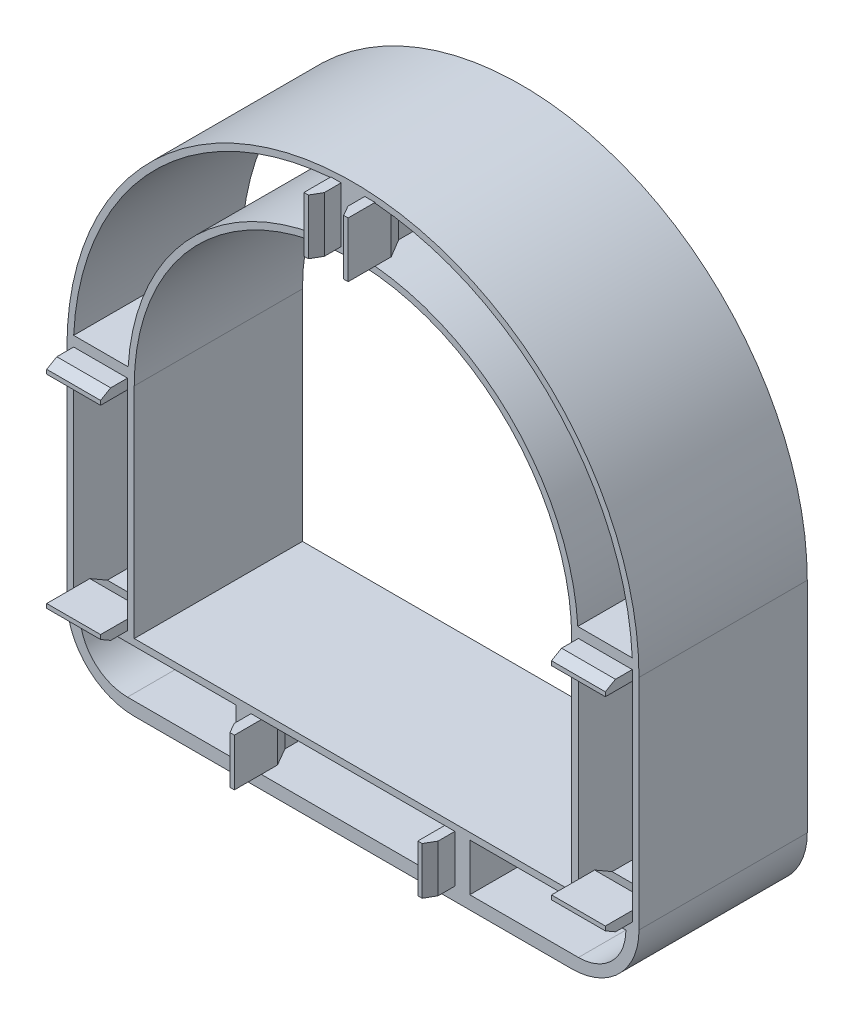
from build123d import *
from OCP.BRepFilletAPI import BRepFilletAPI_MakeChamfer

# Parameters (mm, degrees)
CROQUIS1_W              = 16
CROQUIS1_H              = 65
CROQUIS1_W_2            = 60.56813556
CROQUIS1_H_2            = 14.096609531
SALIENTE_EXTRUIR1_DEPTH = 50
CROQUIS3_W              = 16
CROQUIS3_H              = 3
CROQUIS3_W_2            = 3.053388568
CROQUIS3_H_2            = 16.41437111
CROQUIS3_W_3            = 3.044949639
CROQUIS3_H_3            = 14.096609531
CROQUIS3_W_4            = 3.024386733
SALIENTE_EXTRUIR2_DEPTH = 18
CHAFL_N2_SIZE           = 3
CHAFL_N2_SIZE2          = 1.732050808
CHAFL_N3_SIZE           = 5.196152423
CHAFL_N3_SIZE_2         = 3


with BuildPart() as part:
    # Croquis1 → Saliente-Extruir1 (new body)
    with BuildSketch(Plane.XY):
        with BuildLine():
            Line((-85, 0), (-85, -65))
            ThreePointArc((-85, -65), (-79.142135624, -79.142135624), (-65, -85))
            Line((-65, -85), (65, -85))
            ThreePointArc((65, -85), (79.142135624, -79.142135624), (85, -65))
            Line((85, -65), (85, 0))
            ThreePointArc((85, 0), (0, 85), (-85, 0))
        make_face()
        with Locations((75, -31.476837664)):
            Rectangle(CROQUIS1_W, CROQUIS1_H, mode=Mode.SUBTRACT)
        with BuildLine():
            Line((-65, -65), (65, -65))
            Line((65, -65), (65, 0))
            ThreePointArc((65, 0), (0, 65), (-65, 0))
            Line((-65, 0), (-65, -65))
        make_face(mode=Mode.SUBTRACT)
        with Locations((-75, -31.476837664)):
            Rectangle(CROQUIS1_W, CROQUIS1_H, mode=Mode.SUBTRACT)
        with BuildLine():
            Line((3.510152615, 83.023277843), (3.510152615, 66.83939974))
            ThreePointArc((3.510152615, 66.83939974), (47.145709065, 47.509037517), (66.810483413, 4.023162336))
            Line((66.810483413, 4.023162336), (83, 4.023162336))
            ThreePointArc((83, 4.023162336), (58.576925397, 58.940051292), (3.510152615, 83.023277843))
        make_face(mode=Mode.SUBTRACT)
        with BuildLine():
            Line((-66.810483413, 4.023162336), (-83, 4.023162336))
            ThreePointArc((-83, 4.023162336), (-58.576925397, 58.940051292), (-3.510152615, 83.023277843))
            Line((-3.510152615, 83.023277843), (-3.510152615, 66.83939974))
            ThreePointArc((-3.510152615, 66.83939974), (-47.145709065, 47.509037517), (-66.810483413, 4.023162336))
        make_face(mode=Mode.SUBTRACT)
        with BuildLine():
            Line((-81.096609531, -66.976837664), (-34.71593222, -66.976837664))
            Line((-34.71593222, -66.976837664), (-34.71593222, -81.073447195))
            Line((-34.71593222, -81.073447195), (-67, -81.073447195))
            ThreePointArc((-67, -81.073447195), (-76.967808191, -76.944645855), (-81.096609531, -66.976837664))
        make_face(mode=Mode.SUBTRACT)
        with BuildLine():
            Line((67, -81.073447195), (34.71593222, -81.073447195))
            Line((34.71593222, -81.073447195), (34.71593222, -66.976837664))
            Line((34.71593222, -66.976837664), (81.096609531, -66.976837664))
            ThreePointArc((81.096609531, -66.976837664), (76.967808191, -76.944645855), (67, -81.073447195))
        make_face(mode=Mode.SUBTRACT)
        with Locations((0, -74.025142429)):
            Rectangle(CROQUIS1_W_2, CROQUIS1_H_2, mode=Mode.SUBTRACT)
    extrude(amount=SALIENTE_EXTRUIR1_DEPTH)

    # Croquis3 → Saliente-Extruir2 (add)
    with BuildSketch(Plane.XY.offset(40)):
        with Locations((-75, -0.476837664)):
            Rectangle(CROQUIS3_W, CROQUIS3_H)
        with Locations((-75, -62.476837664)):
            Rectangle(CROQUIS3_W, CROQUIS3_H)
        with Locations((75, -62.476837664)):
            Rectangle(CROQUIS3_W, CROQUIS3_H)
        with Locations((75, -0.476837664)):
            Rectangle(CROQUIS3_W, CROQUIS3_H)
        with Locations((-5.036846899, 74.816092288)):
            Rectangle(CROQUIS3_W_2, CROQUIS3_H_2)
        with Locations((5.036846899, 74.816092288)):
            Rectangle(CROQUIS3_W_2, CROQUIS3_H_2)
        with Locations((-28.761592961, -74.025142429)):
            Rectangle(CROQUIS3_W_3, CROQUIS3_H_3)
        with Locations((28.771874414, -74.025142429)):
            Rectangle(CROQUIS3_W_4, CROQUIS3_H_3)
    extrude(amount=SALIENTE_EXTRUIR2_DEPTH)

    # Chaflán2: one chamfer whose edges measure the first distance from different faces: ONE call of the kernel's chamfer builder (chamfer() names one face for all edges)
    chafl_n2_edges_1 = [part.edges().sort_by_distance(p)[0] for p in [
        (-75, 1.023162336, 58),
    ]]
    chafl_n2_side_1 = [part.faces().sort_by_distance(p)[0] for p in [
        (-75, 1.023162336, 54),
    ]]
    chafl_n2_edges_2 = [part.edges().sort_by_distance(p)[0] for p in [
        (-75, -63.976837664, 58),
    ]]
    chafl_n2_side_2 = [part.faces().sort_by_distance(p)[0] for p in [
        (-75, -63.976837664, 54),
    ]]
    chafl_n2_edges_3 = [part.edges().sort_by_distance(p)[0] for p in [
        (75, -63.976837664, 58),
    ]]
    chafl_n2_side_3 = [part.faces().sort_by_distance(p)[0] for p in [
        (75, -63.976837664, 54),
    ]]
    chafl_n2_edges_4 = [part.edges().sort_by_distance(p)[0] for p in [
        (75, 1.023162336, 58),
    ]]
    chafl_n2_side_4 = [part.faces().sort_by_distance(p)[0] for p in [
        (75, 1.023162336, 54),
    ]]
    chafl_n2_edges_5 = [part.edges().sort_by_distance(p)[0] for p in [
        (-3.510152615, 74.816092288, 58),
    ]]
    chafl_n2_side_5 = [part.faces().sort_by_distance(p)[0] for p in [
        (-3.510152615, 74.816092288, 54),
    ]]
    chafl_n2_edges_6 = [part.edges().sort_by_distance(p)[0] for p in [
        (3.510152615, 74.816092288, 58),
    ]]
    chafl_n2_side_6 = [part.faces().sort_by_distance(p)[0] for p in [
        (3.510152615, 74.816092288, 54),
    ]]
    chafl_n2_edges_7 = [part.edges().sort_by_distance(p)[0] for p in [
        (-30.28406778, -74.025142429, 58),
    ]]
    chafl_n2_side_7 = [part.faces().sort_by_distance(p)[0] for p in [
        (-30.28406778, -74.025142429, 54),
    ]]
    chafl_n2_edges_8 = [part.edges().sort_by_distance(p)[0] for p in [
        (30.28406778, -74.025142429, 58),
    ]]
    chafl_n2_side_8 = [part.faces().sort_by_distance(p)[0] for p in [
        (30.28406778, -74.025142429, 54),
    ]]
    chafl_n2 = BRepFilletAPI_MakeChamfer(part.part.solid().wrapped)
    for e in chafl_n2_edges_1:
        chafl_n2.Add(CHAFL_N2_SIZE, CHAFL_N2_SIZE2, e.wrapped, chafl_n2_side_1[0].wrapped)  # the first distance lies on this face
    for e in chafl_n2_edges_2:
        chafl_n2.Add(CHAFL_N2_SIZE, CHAFL_N2_SIZE2, e.wrapped, chafl_n2_side_2[0].wrapped)  # the first distance lies on this face
    for e in chafl_n2_edges_3:
        chafl_n2.Add(CHAFL_N2_SIZE, CHAFL_N2_SIZE2, e.wrapped, chafl_n2_side_3[0].wrapped)  # the first distance lies on this face
    for e in chafl_n2_edges_4:
        chafl_n2.Add(CHAFL_N2_SIZE, CHAFL_N2_SIZE2, e.wrapped, chafl_n2_side_4[0].wrapped)  # the first distance lies on this face
    for e in chafl_n2_edges_5:
        chafl_n2.Add(CHAFL_N2_SIZE, CHAFL_N2_SIZE2, e.wrapped, chafl_n2_side_5[0].wrapped)  # the first distance lies on this face
    for e in chafl_n2_edges_6:
        chafl_n2.Add(CHAFL_N2_SIZE, CHAFL_N2_SIZE2, e.wrapped, chafl_n2_side_6[0].wrapped)  # the first distance lies on this face
    for e in chafl_n2_edges_7:
        chafl_n2.Add(CHAFL_N2_SIZE, CHAFL_N2_SIZE2, e.wrapped, chafl_n2_side_7[0].wrapped)  # the first distance lies on this face
    for e in chafl_n2_edges_8:
        chafl_n2.Add(CHAFL_N2_SIZE, CHAFL_N2_SIZE2, e.wrapped, chafl_n2_side_8[0].wrapped)  # the first distance lies on this face
    add(Compound.cast(chafl_n2.Shape()), mode=Mode.REPLACE)

    # Chaflán3
    chafl_n3_edges_1 = [part.edges().sort_by_distance(p)[0] for p in [
        (75, -60.976837664, 40),
    ]]
    chafl_n3_side_1 = [part.faces().sort_by_distance(p)[0] for p in [
        (75, -60.976837664, 40.06),
    ]]
    chafl_n3_edges_2 = [part.edges().sort_by_distance(p)[0] for p in [
        (75, -1.976837664, 40),
    ]]
    chafl_n3_side_2 = [part.faces().sort_by_distance(p)[0] for p in [
        (75, -1.976837664, 40.06),
    ]]
    chafl_n3_edges_3 = [part.edges().sort_by_distance(p)[0] for p in [
        (27.259681047, -74.025142429, 40),
    ]]
    chafl_n3_side_3 = [part.faces().sort_by_distance(p)[0] for p in [
        (27.319681047, -74.025142429, 40),
    ]]
    chafl_n3_edges_4 = [part.edges().sort_by_distance(p)[0] for p in [
        (-27.239118141, -74.025142429, 40),
    ]]
    chafl_n3_side_4 = [part.faces().sort_by_distance(p)[0] for p in [
        (-27.239118141, -74.025142429, 40.06),
    ]]
    chafl_n3_edges_5 = [part.edges().sort_by_distance(p)[0] for p in [
        (-75, -60.976837664, 40),
    ]]
    chafl_n3_side_5 = [part.faces().sort_by_distance(p)[0] for p in [
        (-75, -60.976837664, 40.06),
    ]]
    chafl_n3_edges_6 = [part.edges().sort_by_distance(p)[0] for p in [
        (-75, -1.976837664, 40),
    ]]
    chafl_n3_side_6 = [part.faces().sort_by_distance(p)[0] for p in [
        (-75, -1.976837664, 40.06),
    ]]
    chafl_n3_edges_7 = [part.edges().sort_by_distance(p)[0] for p in [
        (-6.563541183, 74.72336741, 40),
    ]]
    chafl_n3_side_7 = [part.faces().sort_by_distance(p)[0] for p in [
        (-6.563541183, 74.72336741, 40.06),
    ]]
    chafl_n3_edges_8 = [part.edges().sort_by_distance(p)[0] for p in [
        (6.563541183, 74.72336741, 40),
    ]]
    chafl_n3_side_8 = [part.faces().sort_by_distance(p)[0] for p in [
        (6.563541183, 74.72336741, 40.06),
    ]]
    chafl_n3 = BRepFilletAPI_MakeChamfer(part.part.solid().wrapped)
    for e in chafl_n3_edges_1:
        chafl_n3.Add(CHAFL_N3_SIZE - 0.0001, CHAFL_N3_SIZE_2 - 0.0001, e.wrapped, chafl_n3_side_1[0].wrapped)
    for e in chafl_n3_edges_2:
        chafl_n3.Add(CHAFL_N3_SIZE - 0.0001, CHAFL_N3_SIZE_2 - 0.0001, e.wrapped, chafl_n3_side_2[0].wrapped)
    for e in chafl_n3_edges_3:
        chafl_n3.Add(CHAFL_N3_SIZE_2 - 0.0001, CHAFL_N3_SIZE - 0.0001, e.wrapped, chafl_n3_side_3[0].wrapped)
    for e in chafl_n3_edges_4:
        chafl_n3.Add(CHAFL_N3_SIZE - 0.0001, CHAFL_N3_SIZE_2 - 0.0001, e.wrapped, chafl_n3_side_4[0].wrapped)
    for e in chafl_n3_edges_5:
        chafl_n3.Add(CHAFL_N3_SIZE - 0.0001, CHAFL_N3_SIZE_2 - 0.0001, e.wrapped, chafl_n3_side_5[0].wrapped)
    for e in chafl_n3_edges_6:
        chafl_n3.Add(CHAFL_N3_SIZE - 0.0001, CHAFL_N3_SIZE_2 - 0.0001, e.wrapped, chafl_n3_side_6[0].wrapped)
    for e in chafl_n3_edges_7:
        chafl_n3.Add(CHAFL_N3_SIZE - 0.0001, CHAFL_N3_SIZE_2 - 0.0001, e.wrapped, chafl_n3_side_7[0].wrapped)
    for e in chafl_n3_edges_8:
        chafl_n3.Add(CHAFL_N3_SIZE - 0.0001, CHAFL_N3_SIZE_2 - 0.0001, e.wrapped, chafl_n3_side_8[0].wrapped)
    add(Compound.cast(chafl_n3.Shape()), mode=Mode.REPLACE)  # a hair under: the kernel refuses the full size


solid = part.part
